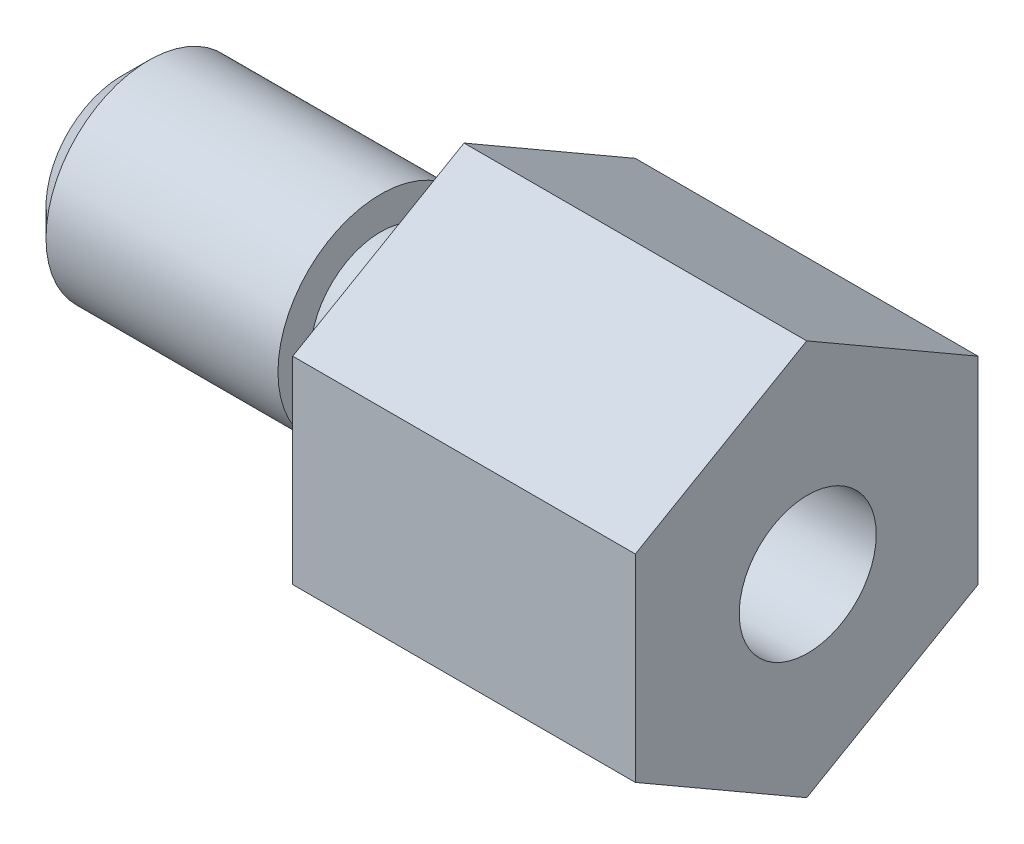
from build123d import *

# Parameters (mm, degrees)
BOSS_EXTRU_1_DEPTH                = 5
DIAM_TRE_DU_PER_AGE_2_0_2_1_D     = 2
DIAM_TRE_DU_PER_AGE_2_0_2_1_DEPTH = 10
DIAM_TRE_DU_PER_AGE_2_0_2_1_TIP   = 0.600860619
CHANFREIN1_SIZE                   = 0.4


with BuildPart() as part:
    # Esquisse1 → Boss.-Extru.1 (new body)
    with BuildSketch(Plane(origin=(0, 0, 0), x_dir=(0, -1, 0), z_dir=(-1, 0, 0))):
        Polygon((-1.443375672, -2.5), (1.443375674, -2.5), (2.886751347, 1e-09), (1.443375673, 2.5), (-1.443375673, 2.5), (-2.886751345, 1e-09), align=None)
    extrude(amount=-BOSS_EXTRU_1_DEPTH)

    # Esquisse2 → Révolution1 (revolve)
    with BuildSketch(Plane(origin=(0, 0, 0), x_dir=(-1, 0, 0), z_dir=(0, 0, -1)), mode=Mode.PRIVATE) as r_volution1_sk:
        Polygon((0, 1.157712139), (0, 0.13332547), (5, 0.13332547), (5, 1.63332547), (1.215350333, 1.63332547), (1.215350333, 1.157712139), align=None)
    revolve(r_volution1_sk.sketch.rotate(Axis((0, 0.13332547, 0), (-1, 0, 0)), 270), axis=Axis((0, 0.13332547, 0), (-1, 0, 0)))

    # Diamètre du perçage Ø2.0 (2)1
    with Locations(Plane(origin=(5, 0, 0), x_dir=(0, 0, -1), z_dir=(1, 0, 0))):
        with Locations((0.015228416, -0.068295067)):
            Hole(DIAM_TRE_DU_PER_AGE_2_0_2_1_D / 2, depth=DIAM_TRE_DU_PER_AGE_2_0_2_1_DEPTH)
            with Locations((0, 0, -(DIAM_TRE_DU_PER_AGE_2_0_2_1_DEPTH + DIAM_TRE_DU_PER_AGE_2_0_2_1_TIP / 2))):  # 118° drill point
                Cone(0, DIAM_TRE_DU_PER_AGE_2_0_2_1_D / 2, DIAM_TRE_DU_PER_AGE_2_0_2_1_TIP, mode=Mode.SUBTRACT)

    # Chanfrein1
    # the kernel refuses this chamfer: 0.4 mm, written as the material it takes off along each edge
    with BuildSketch(Plane(origin=(-5, 0.13332547, 0), x_dir=(0, 0, 1), z_dir=(0, -1, 0))) as chanfrein1_piece_1:
        Polygon((1.5, -CHANFREIN1_SIZE), (1.5 - CHANFREIN1_SIZE, 0), (1.5, 0), align=None)
    revolve(axis=Axis((-5, 0.13332547, 0), (-1, 0, 0)), mode=Mode.SUBTRACT)


solid = part.part
